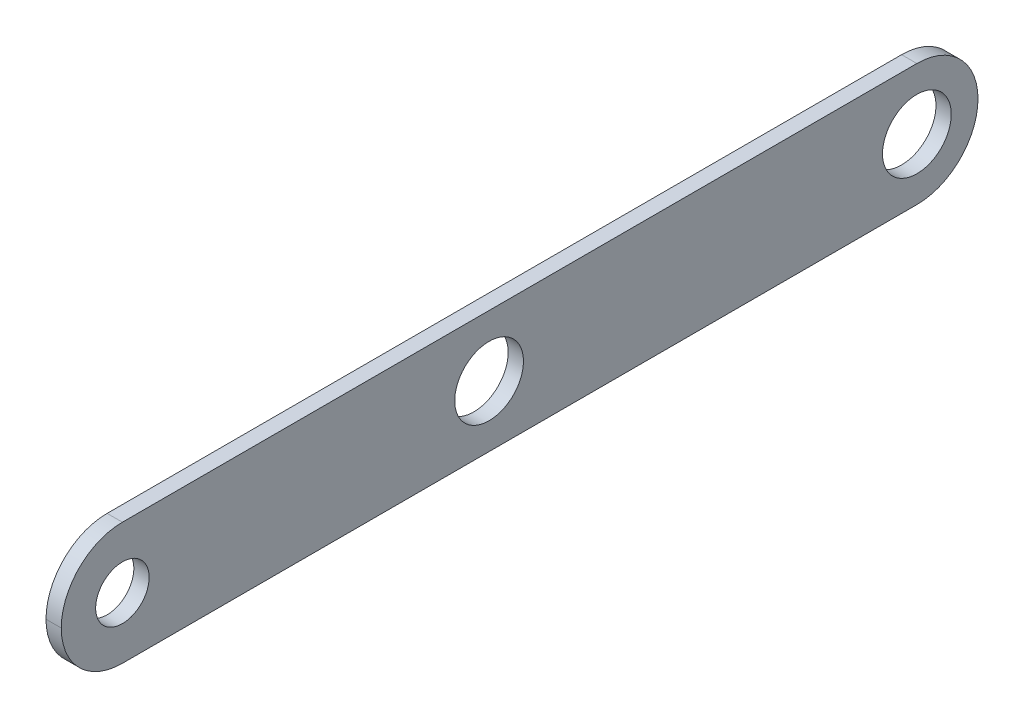
from build123d import *

# Parameters (mm, degrees)
SKETCH1_W           = 381
SKETCH1_H           = 50.8
SKETCH1_R           = 11.1125
SKETCH1_R_2         = 14.2875
BOSS_EXTRUDE1_DEPTH = 6.35
FILLET3_R           = 25.4


with BuildPart() as part:
    # Sketch1 → Boss-Extrude1 (new body)
    with BuildSketch(Plane(origin=(0, 0, 0), x_dir=(0, 0, -1), z_dir=(1, 0, 0))):
        with Locations((190.5, 25.4)):
            Rectangle(SKETCH1_W, SKETCH1_H)
        with Locations((25.4, 25.4)):
            Circle(SKETCH1_R, mode=Mode.SUBTRACT)
        with Locations(Location((355.6, 25.4, 0), (0, 0, 180))):
            Circle(SKETCH1_R_2, mode=Mode.SUBTRACT)
        with Locations((177.8, 25.4)):
            Circle(SKETCH1_R_2, mode=Mode.SUBTRACT)
    extrude(amount=BOSS_EXTRUDE1_DEPTH)

    # Fillet3
    fillet3_edges = [part.edges().sort_by_distance(p)[0] for p in [
        (3.175, 0, 0),
        (3.175, 50.8, 0),
        (3.175, 0, -381),
        (3.175, 50.8, -381),
    ]]
    fillet(fillet3_edges, radius=FILLET3_R - 0.0001)  # a hair under: the kernel refuses the full size


solid = part.part
